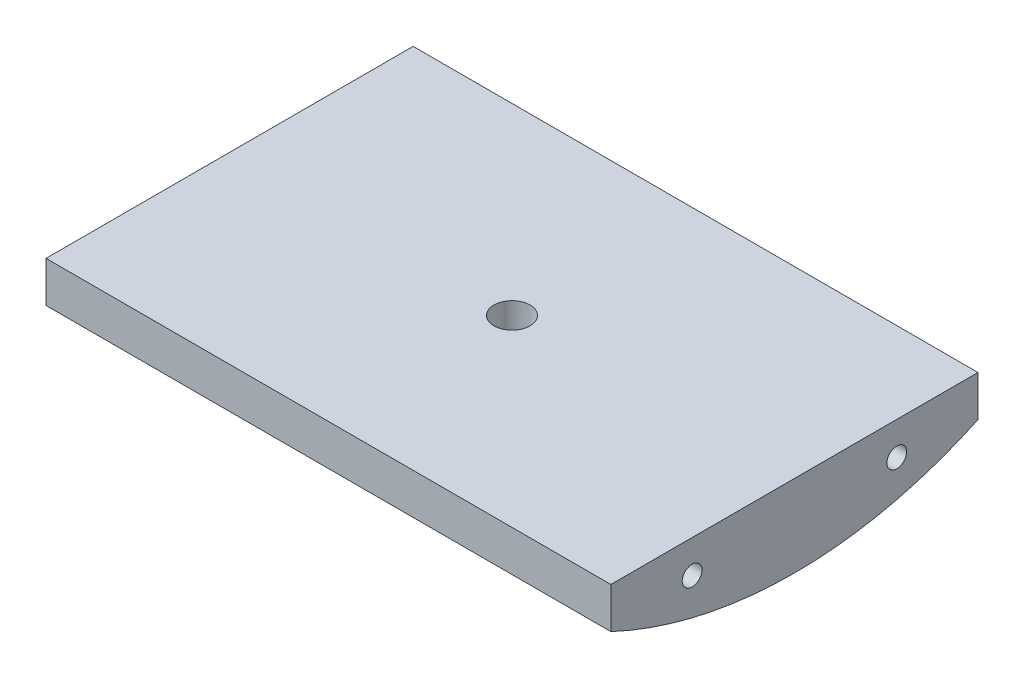
from build123d import *

# Parameters (mm, degrees)
SKETCH1_R           = 1.75
BOSS_EXTRUDE1_DEPTH = 100
SKETCH2_R           = 3.2
CUT_EXTRUDE1_DEPTH  = 107.143770425


with BuildPart() as part:
    # Sketch1 → Boss-Extrude1 (new body)
    with BuildSketch(Plane(origin=(0, 0, 0), x_dir=(0, 0, -1), z_dir=(1, 0, 0))):
        with BuildLine():
            Line((-32.5, -61.79), (32.5, -61.79))
            Line((32.5, -61.79), (32.5, -69.021113436))
            ThreePointArc((32.5, -69.021113436), (0, -76.29), (-32.5, -69.021113436))
            Line((-32.5, -69.021113436), (-32.5, -61.79))
        make_face()
        with Locations((18.117333157, -67.61480784)):
            Circle(SKETCH1_R, mode=Mode.SUBTRACT)
        with Locations((-18.117333157, -67.61480784)):
            Circle(SKETCH1_R, mode=Mode.SUBTRACT)
    extrude(amount=BOSS_EXTRUDE1_DEPTH)

    # Sketch2 → Cut-Extrude1 (cut, through all)
    with BuildSketch(Plane(origin=(0, -61.79, 0), x_dir=(1, 0, 0), z_dir=(0, 1, 0))):
        with Locations((50, 0)):
            Circle(SKETCH2_R)
    extrude(amount=-CUT_EXTRUDE1_DEPTH, mode=Mode.SUBTRACT)


solid = part.part
